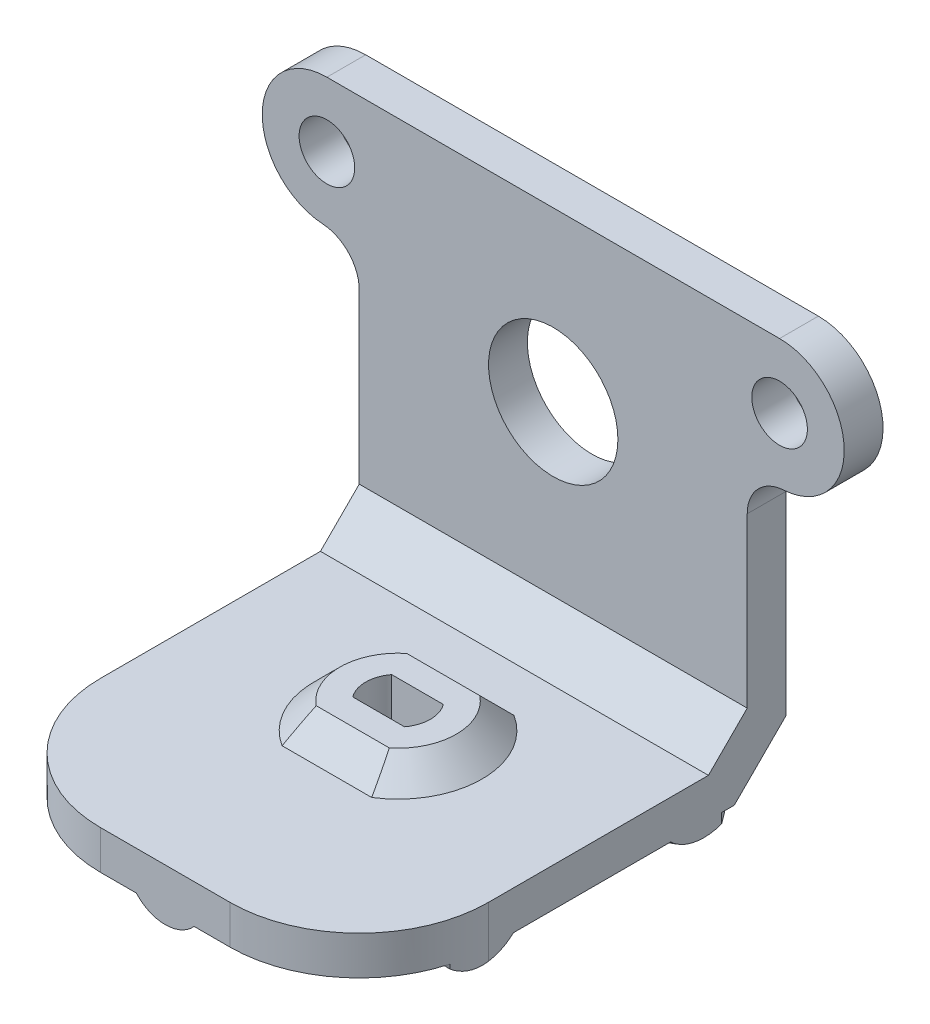
from build123d import *

# Parameters (mm, degrees)
SKETCH1_W               = 45
SKETCH1_H               = 32
SKETCH1_R               = 2.15
SKETCH1_R_2             = 5
BOSS_EXTRUDE1_DEPTH     = 3
SKETCH3_W               = 30
SKETCH3_H               = 3
EXTRUDE_THIN1_DEPTH     = 15
CUT_EXTRUDE1_DEPTH      = 50.35838328
CUT_EXTRUDE2_DEPTH      = 47.208765402
CUT_EXTRUDE2_DEPTH_BACK = 47.208765402
SKETCH5_W               = 7.5
SKETCH5_H               = 22
EXTRUDE_THIN2_START     = 2
EXTRUDE_THIN2_DEPTH     = 2
CHAMFER1_SIZE           = 3
BOSS_EXTRUDE3_DEPTH     = 8
CIRPATTERN1_COUNT       = 6
CHAMFER4_SIZE           = 3
FILLET1_R               = 10
CHAMFER2_SIZE           = 4
CHAMFER3_SIZE           = 3
FILLET2_R               = 5
FILLET3_R               = 3
INTERSECT1_START        = -28.000000924
INTERSECT1_DEPTH        = 1.000000924


# Read off the part's stored shape, not the designer's step: Intersect1
# Some blends are built 0.0001 mm under size
with BuildPart() as part:
    # Sketch1 → Boss-Extrude1 (new body)
    with BuildSketch(Plane.XY):
        with Locations((0, -11)):
            Rectangle(SKETCH1_W, SKETCH1_H)
        with Locations((-17.5, 0)):
            Circle(SKETCH1_R, mode=Mode.SUBTRACT)
        with Locations(Location((17.5, 0, 0), (0, 0, 180))):
            Circle(SKETCH1_R, mode=Mode.SUBTRACT)
        with Locations((0, -8)):
            Circle(SKETCH1_R_2, mode=Mode.SUBTRACT)
    extrude(amount=BOSS_EXTRUDE1_DEPTH)

    # Sketch3 → Extrude-Thin1 (add, symmetric)
    with BuildSketch(Plane.ZY):
        with Locations((18, -25.5)):
            Rectangle(SKETCH3_W, SKETCH3_H)
    extrude(amount=EXTRUDE_THIN1_DEPTH, both=True)

    # Sketch4 → Cut-Extrude1 (cut, through all)
    with BuildSketch(Plane(origin=(0, -24, 0), x_dir=(1, 0, 0), z_dir=(0, 1, 0))):
        with BuildLine():
            Line((-2, -13.5), (2, -13.5))
            ThreePointArc((2, -13.5), (2.5, -15), (2, -16.5))
            Line((2, -16.5), (-2, -16.5))
            ThreePointArc((-2, -16.5), (-2.5, -15), (-2, -13.5))
        make_face()
    extrude(amount=-CUT_EXTRUDE1_DEPTH, mode=Mode.SUBTRACT)

    # Sketch5 → Cut-Extrude2 (cut, two sides: drawn at the far end of the back side and taken through both)
    with BuildSketch(Plane.XY.offset(3).offset(-CUT_EXTRUDE2_DEPTH_BACK)):
        with Locations((-18.75, -16)):
            Rectangle(SKETCH5_W, SKETCH5_H)
        with Locations((18.75, -16)):
            Rectangle(SKETCH5_W, SKETCH5_H)
    extrude(amount=CUT_EXTRUDE2_DEPTH + CUT_EXTRUDE2_DEPTH_BACK, mode=Mode.SUBTRACT)

    # Sketch6 → Extrude-Thin2 (add)
    with BuildSketch(Plane(origin=(0, -24, 0), x_dir=(1, 0, 0), z_dir=(0, 1, 0)).offset(EXTRUDE_THIN2_START)):
        with BuildLine():
            Line((-2.449489743, -17.5), (2.449489743, -17.5))
            ThreePointArc((2.449489743, -17.5), (3.5, -15), (2.449489743, -12.5))
            Line((2.449489743, -12.5), (-2.449489743, -12.5))
            ThreePointArc((-2.449489743, -12.5), (-3.5, -15), (-2.449489743, -17.5))
        make_face()
        with BuildLine():
            Line((-2, -16.5), (2, -16.5))
            ThreePointArc((2, -16.5), (2.5, -15), (2, -13.5))
            Line((2, -13.5), (-2, -13.5))
            ThreePointArc((-2, -13.5), (-2.5, -15), (-2, -16.5))
        make_face(mode=Mode.SUBTRACT)
    extrude(amount=-EXTRUDE_THIN2_DEPTH)

    # Chamfer1
    # the kernel refuses this chamfer: 3 mm, written as the material it adds along each edge
    with BuildSketch(Plane(origin=(10.164538707, -24, 12.5), x_dir=(0, -0.02749587661058678, -0.9996219169112968), z_dir=(-1, 0, 0))) as chamfer1_piece_1_section:
        Polygon((CHAMFER1_SIZE * 0.999621916911, -CHAMFER1_SIZE * 0.0274958766106), (-CHAMFER1_SIZE * 0.0274958766106, -CHAMFER1_SIZE * 0.999621916911), (0, 0), align=None)
    chamfer1_piece_1 = extrude(amount=20.329077413, mode=Mode.PRIVATE)
    chamfer1_piece_1 = split(chamfer1_piece_1, bisect_by=Plane(origin=(7e-09, -22, 12.12784901), z_dir=(0, -1, 0)), keep=Keep.TOP, mode=Mode.PRIVATE)
    chamfer1_piece_1 = chamfer1_piece_1 & Plane(origin=(0, -23.022077553, 15), x_dir=(0.699854212223763, 0, 0.7142857142857164), z_dir=(0, 1, 0)) * Cylinder(3.5, 53, mode=Mode.PRIVATE)
    add(chamfer1_piece_1)
    with BuildSketch(Plane(origin=(0, -24, 15), x_dir=(0.9901066627399402, 0, -0.140316771620424), z_dir=(0.140316771620424, 0, 0.9901066627399402))) as chamfer1_piece_2_section:
        Polygon((3.5 + CHAMFER1_SIZE, 0), (3.5, CHAMFER1_SIZE), (3.5, 0), align=None)
    chamfer1_piece_2 = revolve(axis=Axis((0, -24, 15), (0, 1, 0)), revolution_arc=343.867646272, mode=Mode.PRIVATE)
    chamfer1_piece_2 = split(chamfer1_piece_2, bisect_by=Plane(origin=(4.19137438, -22, 13.401943095), z_dir=(0, -1, 0)), keep=Keep.TOP, mode=Mode.PRIVATE)
    chamfer1_piece_2 = split(chamfer1_piece_2, bisect_by=Plane(origin=(4.19137438, -23.188236886, 17.5), z_dir=(0, 0, -1)), keep=Keep.TOP, mode=Mode.PRIVATE)
    chamfer1_piece_2 = split(chamfer1_piece_2, bisect_by=Plane(origin=(4.19137438, -23.188236886, 12.5), z_dir=(0, 0, 1)), keep=Keep.TOP, mode=Mode.PRIVATE)
    add(chamfer1_piece_2)
    with BuildSketch(Plane(origin=(0, -24, 15), x_dir=(-0.9901066627399404, 0, 0.14031677162042244), z_dir=(-0.14031677162042244, 0, -0.9901066627399404))) as chamfer1_piece_3_section:
        Polygon((3.5, CHAMFER1_SIZE), (3.5 + CHAMFER1_SIZE, 0), (3.5, 0), align=None)
    chamfer1_piece_3 = revolve(axis=Axis((0, -24, 15), (0, 1, 0)), revolution_arc=343.867646272, mode=Mode.PRIVATE)
    chamfer1_piece_3 = split(chamfer1_piece_3, bisect_by=Plane(origin=(-4.191374251, -22, 16.598056899), z_dir=(0, -1, 0)), keep=Keep.TOP, mode=Mode.PRIVATE)
    chamfer1_piece_3 = split(chamfer1_piece_3, bisect_by=Plane(origin=(-4.191374251, -23.188236825, 17.5), z_dir=(0, 0, -1)), keep=Keep.TOP, mode=Mode.PRIVATE)
    chamfer1_piece_3 = split(chamfer1_piece_3, bisect_by=Plane(origin=(-4.191374251, -23.188236825, 12.5), z_dir=(0, 0, 1)), keep=Keep.TOP, mode=Mode.PRIVATE)
    add(chamfer1_piece_3)
    with BuildSketch(Plane(origin=(-10.164538707, -24, 17.5), x_dir=(0, -0.027495876610586768, 0.9996219169112968), z_dir=(1, 0, 0))) as chamfer1_piece_4_section:
        Polygon((CHAMFER1_SIZE * 0.999621916911, -CHAMFER1_SIZE * 0.0274958766106), (-CHAMFER1_SIZE * 0.0274958766106, -CHAMFER1_SIZE * 0.999621916911), (0, 0), align=None)
    chamfer1_piece_4 = extrude(amount=20.329077413, mode=Mode.PRIVATE)
    chamfer1_piece_4 = split(chamfer1_piece_4, bisect_by=Plane(origin=(-7e-09, -22, 17.87215099), z_dir=(0, -1, 0)), keep=Keep.TOP, mode=Mode.PRIVATE)
    chamfer1_piece_4 = chamfer1_piece_4 & Plane(origin=(0, -23.022077553, 15), x_dir=(0.699854212223763, 0, 0.7142857142857164), z_dir=(0, 1, 0)) * Cylinder(3.5, 53, mode=Mode.PRIVATE)
    add(chamfer1_piece_4)
    with BuildSketch(Plane(origin=(0, -24, 15), x_dir=(-0.9901066627399404, 0, 0.14031677162042244), z_dir=(-0.14031677162042244, 0, -0.9901066627399404))) as chamfer1_piece_5a_section:
        Polygon((3.5, CHAMFER1_SIZE), (3.5 + CHAMFER1_SIZE, 0), (3.5, 0), align=None)
    chamfer1_piece_5a = revolve(axis=Axis((0, -24, 15), (0, 1, 0)), revolution_arc=343.867646272, mode=Mode.PRIVATE)
    chamfer1_piece_5a = split(chamfer1_piece_5a, bisect_by=Plane(origin=(0, -22, 10.999585628), z_dir=(0, -1, 0)), keep=Keep.TOP, mode=Mode.PRIVATE)
    chamfer1_piece_5a = split(chamfer1_piece_5a, bisect_by=Plane(origin=(0, -23.271769179, 12.5), z_dir=(0, 0, -1)), keep=Keep.TOP, mode=Mode.PRIVATE)
    with BuildSketch(Plane(origin=(10.164538707, -24, 12.5), x_dir=(0, -0.02749587661058678, -0.9996219169112968), z_dir=(-1, 0, 0))) as chamfer1_piece_5b_section:
        Polygon((CHAMFER1_SIZE * 0.999621916911, -CHAMFER1_SIZE * 0.0274958766106), (-CHAMFER1_SIZE * 0.0274958766106, -CHAMFER1_SIZE * 0.999621916911), (0, 0), align=None)
    chamfer1_piece_5b = extrude(amount=20.329077413, mode=Mode.PRIVATE)
    chamfer1_piece_5b = split(chamfer1_piece_5b, bisect_by=Plane(origin=(0, -22, 11.341108232), z_dir=(0, -1, 0)), keep=Keep.TOP, mode=Mode.PRIVATE)
    chamfer1_piece_5b = chamfer1_piece_5b - Plane(origin=(0, -23.224020782, 15), x_dir=(0.699854212223763, 0, 0.7142857142857164), z_dir=(0, 1, 0)) * Cylinder(3.5, 53, mode=Mode.PRIVATE)
    chamfer1_piece_5 = chamfer1_piece_5a & chamfer1_piece_5b
    add(chamfer1_piece_5)
    with BuildSketch(Plane(origin=(10.164538707, -24, 12.5), x_dir=(0, -0.02749587661058678, -0.9996219169112968), z_dir=(-1, 0, 0))) as chamfer1_piece_6a_section:
        Polygon((CHAMFER1_SIZE * 0.999621916911, -CHAMFER1_SIZE * 0.0274958766106), (-CHAMFER1_SIZE * 0.0274958766106, -CHAMFER1_SIZE * 0.999621916911), (0, 0), align=None)
    chamfer1_piece_6a = extrude(amount=20.329077413, mode=Mode.PRIVATE)
    chamfer1_piece_6a = split(chamfer1_piece_6a, bisect_by=Plane(origin=(0, -22, 11.341108232), z_dir=(0, -1, 0)), keep=Keep.TOP, mode=Mode.PRIVATE)
    chamfer1_piece_6a = chamfer1_piece_6a - Plane(origin=(0, -23.224020782, 15), x_dir=(0.699854212223763, 0, 0.7142857142857164), z_dir=(0, 1, 0)) * Cylinder(3.5, 53, mode=Mode.PRIVATE)
    with BuildSketch(Plane(origin=(0, -24, 15), x_dir=(0.9901066627399402, 0, -0.140316771620424), z_dir=(0.140316771620424, 0, 0.9901066627399402))) as chamfer1_piece_6b_section:
        Polygon((3.5 + CHAMFER1_SIZE, 0), (3.5, CHAMFER1_SIZE), (3.5, 0), align=None)
    chamfer1_piece_6b = revolve(axis=Axis((0, -24, 15), (0, 1, 0)), revolution_arc=343.867646272, mode=Mode.PRIVATE)
    chamfer1_piece_6b = split(chamfer1_piece_6b, bisect_by=Plane(origin=(0, -22, 10.999585483), z_dir=(0, -1, 0)), keep=Keep.TOP, mode=Mode.PRIVATE)
    chamfer1_piece_6b = split(chamfer1_piece_6b, bisect_by=Plane(origin=(0, -23.271769428, 12.5), z_dir=(0, 0, -1)), keep=Keep.TOP, mode=Mode.PRIVATE)
    chamfer1_piece_6 = chamfer1_piece_6a & chamfer1_piece_6b
    add(chamfer1_piece_6)
    with BuildSketch(Plane(origin=(0, -24, 15), x_dir=(0.9901066627399402, 0, -0.140316771620424), z_dir=(0.140316771620424, 0, 0.9901066627399402))) as chamfer1_piece_7a_section:
        Polygon((3.5 + CHAMFER1_SIZE, 0), (3.5, CHAMFER1_SIZE), (3.5, 0), align=None)
    chamfer1_piece_7a = revolve(axis=Axis((0, -24, 15), (0, 1, 0)), revolution_arc=343.867646272, mode=Mode.PRIVATE)
    chamfer1_piece_7a = split(chamfer1_piece_7a, bisect_by=Plane(origin=(2e-09, -22, 19.000414518), z_dir=(0, -1, 0)), keep=Keep.TOP, mode=Mode.PRIVATE)
    chamfer1_piece_7a = split(chamfer1_piece_7a, bisect_by=Plane(origin=(2e-09, -23.271769429, 17.5), z_dir=(0, 0, 1)), keep=Keep.TOP, mode=Mode.PRIVATE)
    with BuildSketch(Plane(origin=(-10.164538707, -24, 17.5), x_dir=(0, -0.027495876610586768, 0.9996219169112968), z_dir=(1, 0, 0))) as chamfer1_piece_7b_section:
        Polygon((CHAMFER1_SIZE * 0.999621916911, -CHAMFER1_SIZE * 0.0274958766106), (-CHAMFER1_SIZE * 0.0274958766106, -CHAMFER1_SIZE * 0.999621916911), (0, 0), align=None)
    chamfer1_piece_7b = extrude(amount=20.329077413, mode=Mode.PRIVATE)
    chamfer1_piece_7b = split(chamfer1_piece_7b, bisect_by=Plane(origin=(1e-09, -22, 18.658891768), z_dir=(0, -1, 0)), keep=Keep.TOP, mode=Mode.PRIVATE)
    chamfer1_piece_7b = chamfer1_piece_7b - Plane(origin=(0, -23.224020782, 15), x_dir=(0.699854212223763, 0, 0.7142857142857164), z_dir=(0, 1, 0)) * Cylinder(3.5, 53, mode=Mode.PRIVATE)
    chamfer1_piece_7 = chamfer1_piece_7a & chamfer1_piece_7b
    add(chamfer1_piece_7)
    with BuildSketch(Plane(origin=(0, -24, 15), x_dir=(-0.9901066627399404, 0, 0.14031677162042244), z_dir=(-0.14031677162042244, 0, -0.9901066627399404))) as chamfer1_piece_8a_section:
        Polygon((3.5, CHAMFER1_SIZE), (3.5 + CHAMFER1_SIZE, 0), (3.5, 0), align=None)
    chamfer1_piece_8a = revolve(axis=Axis((0, -24, 15), (0, 1, 0)), revolution_arc=343.867646272, mode=Mode.PRIVATE)
    chamfer1_piece_8a = split(chamfer1_piece_8a, bisect_by=Plane(origin=(0, -22, 19.000414372), z_dir=(0, -1, 0)), keep=Keep.TOP, mode=Mode.PRIVATE)
    chamfer1_piece_8a = split(chamfer1_piece_8a, bisect_by=Plane(origin=(0, -23.27176918, 17.5), z_dir=(0, 0, 1)), keep=Keep.TOP, mode=Mode.PRIVATE)
    with BuildSketch(Plane(origin=(-10.164538707, -24, 17.5), x_dir=(0, -0.027495876610586768, 0.9996219169112968), z_dir=(1, 0, 0))) as chamfer1_piece_8b_section:
        Polygon((CHAMFER1_SIZE * 0.999621916911, -CHAMFER1_SIZE * 0.0274958766106), (-CHAMFER1_SIZE * 0.0274958766106, -CHAMFER1_SIZE * 0.999621916911), (0, 0), align=None)
    chamfer1_piece_8b = extrude(amount=20.329077413, mode=Mode.PRIVATE)
    chamfer1_piece_8b = split(chamfer1_piece_8b, bisect_by=Plane(origin=(1e-09, -22, 18.658891768), z_dir=(0, -1, 0)), keep=Keep.TOP, mode=Mode.PRIVATE)
    chamfer1_piece_8b = chamfer1_piece_8b - Plane(origin=(0, -23.224020782, 15), x_dir=(0.699854212223763, 0, 0.7142857142857164), z_dir=(0, 1, 0)) * Cylinder(3.5, 53, mode=Mode.PRIVATE)
    chamfer1_piece_8 = chamfer1_piece_8a & chamfer1_piece_8b
    add(chamfer1_piece_8)

    # Sketch8 → Boss-Extrude3 (add)
    with BuildSketch(Plane(origin=(0, 0, 33), x_dir=(-1, 0, 0), z_dir=(0, 0, -1))):
        with BuildLine():
            Line((-2.236067977, -27), (2.236067977, -27))
            ThreePointArc((2.236067977, -27), (0, -28), (-2.236067977, -27))
        make_face()
    boss_extrude3 = extrude(amount=BOSS_EXTRUDE3_DEPTH)

    # CirPattern1: Boss-Extrude3 ×6 about axis
    cirpattern1_axis = Axis((0, 0, 15), (0, 1, 0))
    for i in range(1, CIRPATTERN1_COUNT):
        add(boss_extrude3.rotate(cirpattern1_axis, i * 360 / CIRPATTERN1_COUNT))

    # Chamfer4
    chamfer4_edges = [part.edges().sort_by_distance(p)[0] for p in [
        (0, -27, 0),
    ]]
    chamfer(chamfer4_edges, length=CHAMFER4_SIZE - 0.0001)  # a hair under: the kernel refuses the full size

    # Fillet1
    # the kernel refuses this fillet: 10 mm, written as the material it takes off along each edge
    with BuildSketch(Plane(origin=(-15, -27, 33), x_dir=(0, 0, -1), z_dir=(0, 1, 0))) as fillet1_piece_1:
        with BuildLine():
            CenterArc((FILLET1_R, -FILLET1_R), FILLET1_R, 90, 90)
            Line((0, -FILLET1_R), (0, 0))
            Line((0, 0), (FILLET1_R, 0))
        make_face()
    extrude(amount=28, mode=Mode.SUBTRACT)
    with BuildSketch(Plane(origin=(15, -27, 33), x_dir=(0, 0, -1), z_dir=(0, 1, 0))) as fillet1_piece_2:
        with BuildLine():
            CenterArc((FILLET1_R, FILLET1_R), FILLET1_R, 180, 90)
            Line((0, FILLET1_R), (0, 0))
            Line((0, 0), (FILLET1_R, 0))
        make_face()
    extrude(amount=28, mode=Mode.SUBTRACT)

    # Chamfer2
    # the kernel refuses this chamfer: 4 mm, written as the material it takes off along each edge
    with BuildSketch(Plane(origin=(-25.286731952, -27, 0), x_dir=(0, 0.9996219169112968, -0.027495876610586365), z_dir=(1, 0, 0))) as chamfer2_piece_1_section:
        Polygon((CHAMFER2_SIZE * 0.999621916911, CHAMFER2_SIZE * 0.0274958766106), (-CHAMFER2_SIZE * 0.0274958766106, CHAMFER2_SIZE * 0.999621916911), (0, 0), align=None)
    chamfer2_piece_1 = extrude(amount=33.337395926, mode=Mode.PRIVATE)
    chamfer2_piece_1 = chamfer2_piece_1 - Plane(origin=(0, -25, 0.166625049), x_dir=(0.7453559924999285, -0.6666666666666683, 0), z_dir=(0, 0, -1)) * Cylinder(3, 83, mode=Mode.PRIVATE)
    add(chamfer2_piece_1, mode=Mode.SUBTRACT)
    with BuildSketch(Plane(origin=(-25.286731952, -27, 0), x_dir=(0, 0.9996219169112968, -0.027495876610586365), z_dir=(1, 0, 0))) as chamfer2_piece_2_section:
        Polygon((CHAMFER2_SIZE * 0.999621916911, CHAMFER2_SIZE * 0.0274958766106), (-CHAMFER2_SIZE * 0.0274958766106, CHAMFER2_SIZE * 0.999621916911), (0, 0), align=None)
    chamfer2_piece_2 = extrude(amount=33.337395926, mode=Mode.PRIVATE)
    chamfer2_piece_2 = split(chamfer2_piece_2, bisect_by=Plane(origin=(8e-08, -23.671290362, 0.328809638), z_dir=(0, 0.7071067811865475, -0.7071067811865476)), keep=Keep.TOP, mode=Mode.PRIVATE)
    add(chamfer2_piece_2, mode=Mode.SUBTRACT)
    with BuildSketch(Plane(origin=(-8.050663974, -27, 0), x_dir=(0, 0.9996219169112968, -0.027495876610586365), z_dir=(1, 0, 0))) as chamfer2_piece_3_section:
        Polygon((CHAMFER2_SIZE * 0.999621916911, CHAMFER2_SIZE * 0.0274958766106), (-CHAMFER2_SIZE * 0.0274958766106, CHAMFER2_SIZE * 0.999621916911), (0, 0), align=None)
    chamfer2_piece_3 = extrude(amount=33.337395926, mode=Mode.PRIVATE)
    chamfer2_piece_3 = chamfer2_piece_3 - Plane(origin=(0, -25, 0.16655092), x_dir=(0.7453559924999285, -0.6666666666666683, 0), z_dir=(0, 0, -1)) * Cylinder(3, 83, mode=Mode.PRIVATE)
    add(chamfer2_piece_3, mode=Mode.SUBTRACT)
    with BuildSketch(Plane(origin=(-8.050663974, -27, 0), x_dir=(0, 0.9996219169112968, -0.027495876610586365), z_dir=(1, 0, 0))) as chamfer2_piece_4_section:
        Polygon((CHAMFER2_SIZE * 0.999621916911, CHAMFER2_SIZE * 0.0274958766106), (-CHAMFER2_SIZE * 0.0274958766106, CHAMFER2_SIZE * 0.999621916911), (0, 0), align=None)
    chamfer2_piece_4 = extrude(amount=33.337395926, mode=Mode.PRIVATE)
    chamfer2_piece_4 = split(chamfer2_piece_4, bisect_by=Plane(origin=(8e-08, -23.671290362, 0.328809638), z_dir=(0, 0.7071067811865475, -0.7071067811865476)), keep=Keep.TOP, mode=Mode.PRIVATE)
    add(chamfer2_piece_4, mode=Mode.SUBTRACT)

    # Chamfer3
    chamfer3_edges = [part.edges().sort_by_distance(p)[0] for p in [
        (0, -24, 3),
    ]]
    chamfer(chamfer3_edges, length=CHAMFER3_SIZE)

    # Fillet2
    fillet2_edges = [part.edges().sort_by_distance(p)[0] for p in [
        (22.5, 5, 1.5),
        (22.5, -5, 1.5),
        (-22.5, -5, 1.5),
        (-22.5, 5, 1.5),
    ]]
    fillet(fillet2_edges, radius=FILLET2_R - 0.0001)  # a hair under: the kernel refuses the full size

    # Fillet3
    fillet3_edges = [part.edges().sort_by_distance(p)[0] for p in [
        (15, -5, 1.5),
        (-15, -5, 1.5),
    ]]
    fillet(fillet3_edges, radius=FILLET3_R)

    # Intersect1 outline → Intersect1 (cut)
    with BuildSketch(Plane(origin=(0, 0, 0), x_dir=(1, 0, 0), z_dir=(0, 1, 0)).offset(INTERSECT1_START)):
        with BuildLine():
            Line((16.706491257, -7.936491673), (15, -4.980762114))
            Line((15, -4.980762114), (15, -23))
            ThreePointArc((15, -23), (14.911730056, -24.325747825), (14.648478541, -25.628090913))
            Line((14.648478541, -25.628090913), (16.706491257, -22.063508327))
            Line((16.706491257, -22.063508327), (18, -19.823085465))
            Line((18, -19.823085465), (18, -10.176914535))
            Line((18, -10.176914535), (16.706491257, -7.936491673))
        make_face()
        with BuildLine():
            Line((-15, -23), (-15, -4.980762114))
            Line((-15, -4.980762114), (-16.706491257, -7.936491673))
            Line((-16.706491257, -7.936491673), (-18, -10.176914535))
            Line((-18, -10.176914535), (-18, -19.823085465))
            Line((-18, -19.823085465), (-16.706491257, -22.063508327))
            Line((-16.706491257, -22.063508327), (-14.648478541, -25.628090913))
            ThreePointArc((-14.648478541, -25.628090913), (-14.911730056, -24.325747825), (-15, -23))
        make_face()
    extrude(amount=INTERSECT1_DEPTH, mode=Mode.SUBTRACT)


solid = part.part
